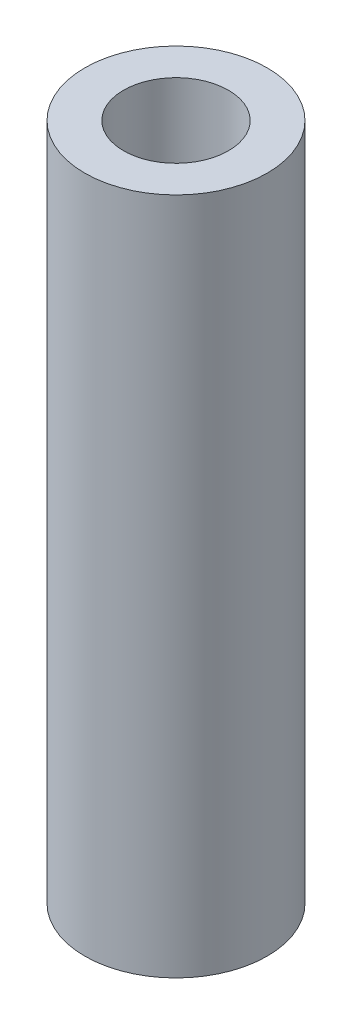
from build123d import *

# Parameters (mm, degrees)
SKETCH1_R           = 5.65
SKETCH1_R_2         = 3.25
BOSS_EXTRUDE1_DEPTH = 42


with BuildPart() as part:
    # Sketch1 → Boss-Extrude1 (new body)
    with BuildSketch(Plane(origin=(0, 0, 0), x_dir=(1, 0, 0), z_dir=(0, 1, 0))):
        Circle(SKETCH1_R)
        Circle(SKETCH1_R_2, mode=Mode.SUBTRACT)
    extrude(amount=BOSS_EXTRUDE1_DEPTH)


solid = part.part
